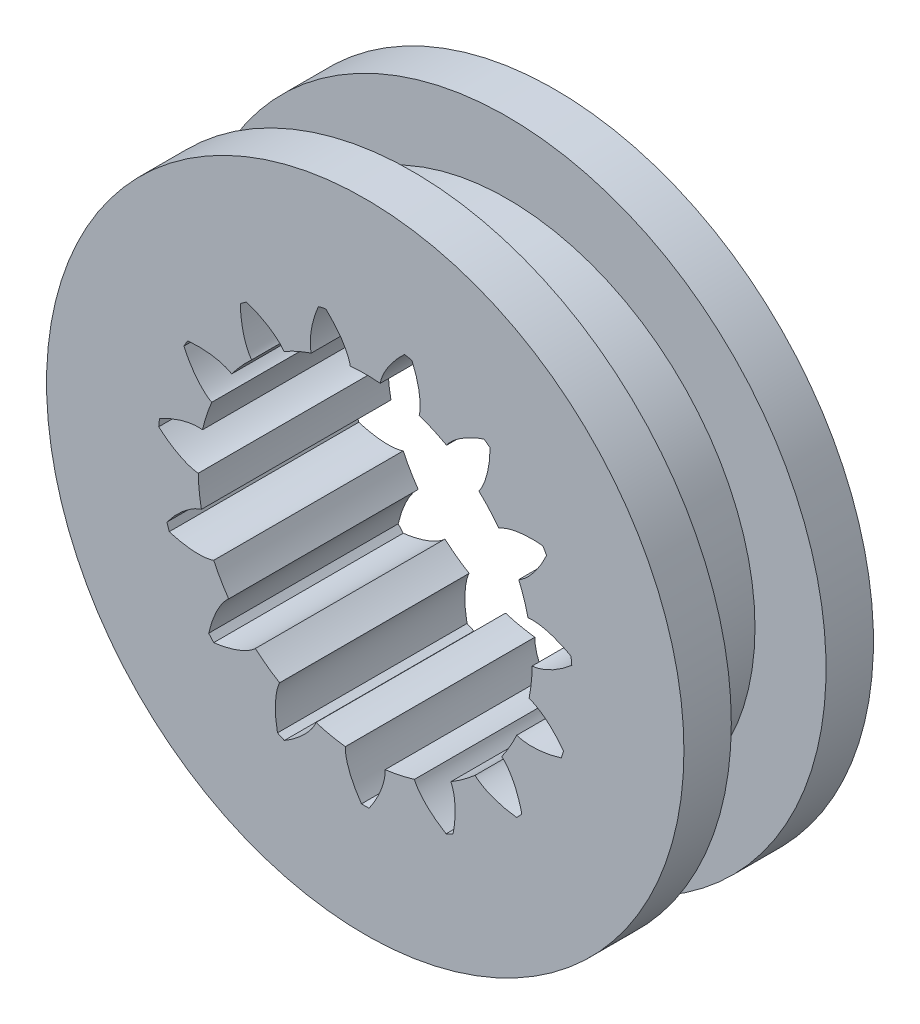
from build123d import *

# Parameters (mm, degrees)
SKETCH_1_R               = 5.226152672
SKETCH_1_R_2             = 4.375
EXTRUDE_1_DEPTH          = 4
EXTRUDE_2_DEPTH          = 4
PATTERN_CIRCULAR_1_COUNT = 15
EXTRUDE_START            = -1
SKETCH_6_R               = 6.726152672
SKETCH_6_R_2             = 5.226152672
EXTRUDE_3_DEPTH          = 1
SKETCH_7_R               = 6.726152672
SKETCH_7_R_2             = 5.226152672
EXTRUDE_4_DEPTH          = 1


with BuildPart() as part:
    # 草图1 → 凸台-拉伸1 (new body)
    with BuildSketch(Plane.XY):
        Circle(SKETCH_1_R)
        Circle(SKETCH_1_R_2, mode=Mode.SUBTRACT)
    extrude(amount=EXTRUDE_1_DEPTH)

    # 草图2 → 凸台-拉伸2 (add)
    with BuildSketch(Plane.XY):
        with BuildLine():
            ThreePointArc((0.31607031, 3.509643792), (0, 3.523847328), (-0.31607031, 3.509643792))
            add(Edge.make_bspline(
                [(-0.31607031, 3.509643792), (-0.317489514, 3.521081143), (-0.320420158, 3.535834937), (-0.324949459, 3.554314244), (-0.328034749, 3.565891921), (-0.331739755, 3.57876045), (-0.336117859, 3.59289901), (-0.341220963, 3.608285328), (-0.347100611, 3.624895512), (-0.353807588, 3.64270413), (-0.361391986, 3.661684207), (-0.369903132, 3.681807247), (-0.379389557, 3.703043255), (-0.389898951, 3.725360758), (-0.401478123, 3.748726822), (-0.414172969, 3.773107082), (-0.428028422, 3.79846576), (-0.443088427, 3.82476569), (-0.459395891, 3.851968348), (-0.476992655, 3.880033875), (-0.495919456, 3.908921106), (-0.516215888, 3.938587597), (-0.537920373, 3.968989654), (-0.561070121, 4.000082368), (-0.585701102, 4.031819639), (-0.61184801, 4.064154213), (-0.639544234, 4.097037714), (-0.668821825, 4.130420675), (-0.699711465, 4.164252574), (-0.732242442, 4.19848187), (-0.766442618, 4.233056038), (-0.802338402, 4.267921604), (-0.839954725, 4.303024185), (-0.879315006, 4.338308526), (-0.934862039, 4.38613503), (-0.978147055, 4.421171995), (-1.007818143, 4.444246795)],
                knots=[0, 0, 0, 0, 0.029141347, 0.03806468, 0.048177792, 0.05948068, 0.071973347, 0.085655791, 0.100528014, 0.116590013, 0.133841791, 0.152283346, 0.171914679, 0.19273579, 0.214746679, 0.237947345, 0.262337789, 0.287918011, 0.314688011, 0.342647788, 0.371797343, 0.402136676, 0.433665787, 0.466384675, 0.500293341, 0.535391785, 0.571680007, 0.609158006, 0.647825783, 0.687683338, 0.728730671, 0.770967781, 0.81439467, 0.859011336, 0.904817779, 1, 1, 1, 1], degree=3))
            ThreePointArc((-1.007818143, 4.444246795), (0, 4.557085361), (1.007818143, 4.444246795))
            add(Edge.make_bspline(
                [(0.31607031, 3.509643792), (0.317489514, 3.521081143), (0.320420158, 3.535834937), (0.324949459, 3.554314244), (0.328034749, 3.565891921), (0.331739755, 3.57876045), (0.336117859, 3.59289901), (0.341220963, 3.608285328), (0.347100611, 3.624895512), (0.353807588, 3.64270413), (0.361391986, 3.661684207), (0.369903132, 3.681807247), (0.379389557, 3.703043255), (0.389898951, 3.725360758), (0.401478123, 3.748726822), (0.414172969, 3.773107082), (0.428028422, 3.79846576), (0.443088427, 3.82476569), (0.459395891, 3.851968348), (0.476992655, 3.880033875), (0.495919456, 3.908921106), (0.516215888, 3.938587597), (0.537920373, 3.968989654), (0.561070121, 4.000082368), (0.585701102, 4.031819639), (0.61184801, 4.064154213), (0.639544234, 4.097037714), (0.668821825, 4.130420675), (0.699711465, 4.164252574), (0.732242442, 4.19848187), (0.766442618, 4.233056038), (0.802338402, 4.267921604), (0.839954725, 4.303024185), (0.879315006, 4.338308526), (0.934862039, 4.38613503), (0.978147055, 4.421171995), (1.007818143, 4.444246795)],
                knots=[0, 0, 0, 0, 0.029141347, 0.03806468, 0.048177792, 0.05948068, 0.071973347, 0.085655791, 0.100528014, 0.116590013, 0.133841791, 0.152283346, 0.171914679, 0.19273579, 0.214746679, 0.237947345, 0.262337789, 0.287918011, 0.314688011, 0.342647788, 0.371797343, 0.402136676, 0.433665787, 0.466384675, 0.500293341, 0.535391785, 0.571680007, 0.609158006, 0.647825783, 0.687683338, 0.728730671, 0.770967781, 0.81439467, 0.859011336, 0.904817779, 1, 1, 1, 1], degree=3))
        make_face()
    extrude_2 = extrude(amount=EXTRUDE_2_DEPTH)

    # 阵列(圆周)1: 凸台-拉伸2 ×15 about axis
    pattern_circular_1_axis = Axis((0, 0, 4), (0, 0, -1))
    for i in range(1, PATTERN_CIRCULAR_1_COUNT):
        add(extrude_2.rotate(pattern_circular_1_axis, i * 360 / PATTERN_CIRCULAR_1_COUNT))

    # 草图6 → 凸台-拉伸3 (add)
    with BuildSketch(Plane.XY.offset(4).offset(EXTRUDE_START)):
        Circle(SKETCH_6_R)
        Circle(SKETCH_6_R_2, mode=Mode.SUBTRACT)
    extrude(amount=EXTRUDE_3_DEPTH)

    # 草图7 → 凸台-拉伸4 (add)
    with BuildSketch(Plane(origin=(0, 0, 0), x_dir=(-1, 0, 0), z_dir=(0, 0, -1))):
        Circle(SKETCH_7_R)
        Circle(SKETCH_7_R_2, mode=Mode.SUBTRACT)
    extrude(amount=-EXTRUDE_4_DEPTH)


solid = part.part
